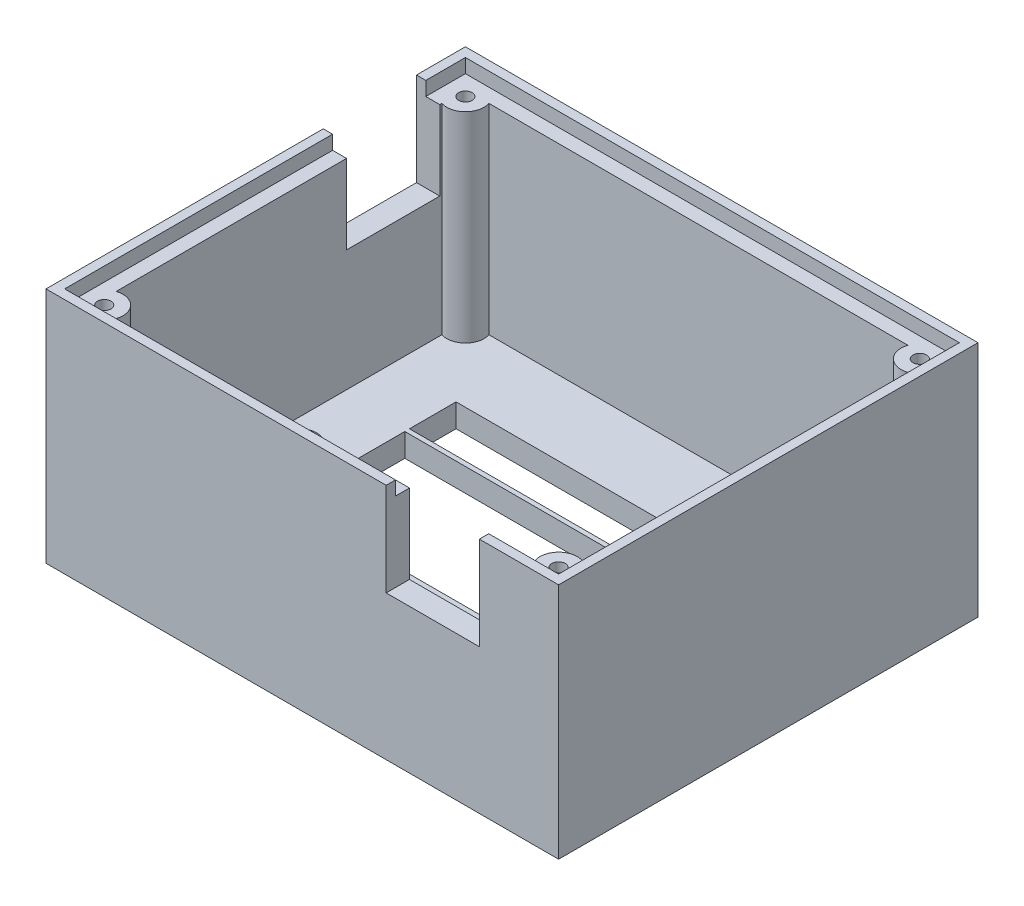
from build123d import *

# Parameters (mm, degrees)
SKETCH1_W                  = 110
SKETCH1_H                  = 90
BOSS_EXTRUDE1_DEPTH        = 51
SKETCH2_W                  = 100
SKETCH2_H                  = 80
CUT_EXTRUDE1_DEPTH         = 46
SKETCH3_W                  = 106
SKETCH3_H                  = 3
CUT_EXTRUDE2_DEPTH         = 3
SKETCH5_W                  = 3
SKETCH5_H                  = 83
CUT_EXTRUDE3_DEPTH         = 3
SKETCH6_W                  = 103
SKETCH6_H                  = 3
CUT_EXTRUDE4_DEPTH         = 3
SKETCH7_W                  = 3
SKETCH7_H                  = 80
CUT_EXTRUDE5_DEPTH         = 3
SKETCH9_R                  = 4
BOSS_EXTRUDE2_DEPTH        = 43
SKETCH10_R                 = 4
BOSS_EXTRUDE3_DEPTH        = 43
M2_5_CLEARANCE_HOLE1_D     = 2.9
M2_5_CLEARANCE_HOLE1_DEPTH = 5
M2_5_CLEARANCE_HOLE1_TIP   = 0.871247898
SKETCH14_W                 = 20
SKETCH14_H                 = 20
CUT_EXTRUDE6_DEPTH         = 5
SKETCH15_W                 = 20
SKETCH15_H                 = 20
CUT_EXTRUDE7_DEPTH         = 5
SKETCH16_W                 = 72
SKETCH16_H                 = 26
CUT_EXTRUDE8_DEPTH         = 5
SKETCH17_W                 = 72
SKETCH17_H                 = 10
CUT_EXTRUDE9_DEPTH         = 5
M6_CLEARANCE_HOLE1_D       = 6.6


with BuildPart() as part:
    # Sketch1 → Boss-Extrude1 (new body)
    with BuildSketch(Plane(origin=(0, 0, 0), x_dir=(1, 0, 0), z_dir=(0, 1, 0))):
        Rectangle(SKETCH1_W, SKETCH1_H)
    extrude(amount=BOSS_EXTRUDE1_DEPTH)

    # Sketch2 → Cut-Extrude1 (cut)
    with BuildSketch(Plane(origin=(0, 51, 0), x_dir=(1, 0, 0), z_dir=(0, 1, 0))):
        Rectangle(SKETCH2_W, SKETCH2_H)
    extrude(amount=-CUT_EXTRUDE1_DEPTH, mode=Mode.SUBTRACT)

    # Sketch3 → Cut-Extrude2 (cut)
    with BuildSketch(Plane(origin=(0, 51, 0), x_dir=(1, 0, 0), z_dir=(0, 1, 0))):
        with Locations((0, 41.5)):
            Rectangle(SKETCH3_W, SKETCH3_H)
    extrude(amount=-CUT_EXTRUDE2_DEPTH, mode=Mode.SUBTRACT)

    # Sketch5 → Cut-Extrude3 (cut)
    with BuildSketch(Plane(origin=(0, 51, 0), x_dir=(1, 0, 0), z_dir=(0, 1, 0))):
        with Locations((51.5, -1.5)):
            Rectangle(SKETCH5_W, SKETCH5_H)
    extrude(amount=-CUT_EXTRUDE3_DEPTH, mode=Mode.SUBTRACT)

    # Sketch6 → Cut-Extrude4 (cut)
    with BuildSketch(Plane(origin=(0, 51, 0), x_dir=(1, 0, 0), z_dir=(0, 1, 0))):
        with Locations((-1.5, -41.5)):
            Rectangle(SKETCH6_W, SKETCH6_H)
    extrude(amount=-CUT_EXTRUDE4_DEPTH, mode=Mode.SUBTRACT)

    # Sketch7 → Cut-Extrude5 (cut)
    with BuildSketch(Plane(origin=(0, 51, 0), x_dir=(1, 0, 0), z_dir=(0, 1, 0))):
        with Locations((-51.5, 0)):
            Rectangle(SKETCH7_W, SKETCH7_H)
    extrude(amount=-CUT_EXTRUDE5_DEPTH, mode=Mode.SUBTRACT)

    # Sketch9 → Boss-Extrude2 (add)
    with BuildSketch(Plane(origin=(0, 5, 0), x_dir=(1, 0, 0), z_dir=(0, 1, 0))):
        with Locations((-48.75, 38.75)):
            Circle(SKETCH9_R)
    extrude(amount=BOSS_EXTRUDE2_DEPTH)

    # Sketch10 → Boss-Extrude3 (add)
    with BuildSketch(Plane(origin=(0, 5, 0), x_dir=(1, 0, 0), z_dir=(0, 1, 0))):
        with Locations((48.75, 38.75)):
            Circle(SKETCH10_R)
        with Locations((48.75, -38.75)):
            Circle(SKETCH10_R)
        with Locations((-48.75, -38.75)):
            Circle(SKETCH10_R)
    extrude(amount=BOSS_EXTRUDE3_DEPTH)

    # M2.5 Clearance Hole1
    with Locations(Plane(origin=(0, 48, 0), x_dir=(1, 0, 0), z_dir=(0, 1, 0))):
        with Locations((-48.75, 38.75), (48.75, 38.75), (48.75, -38.75), (-48.75, -38.75)):
            Hole(M2_5_CLEARANCE_HOLE1_D / 2, depth=M2_5_CLEARANCE_HOLE1_DEPTH)
            with Locations((0, 0, -(M2_5_CLEARANCE_HOLE1_DEPTH + M2_5_CLEARANCE_HOLE1_TIP / 2))):  # 118° drill point
                Cone(0, M2_5_CLEARANCE_HOLE1_D / 2, M2_5_CLEARANCE_HOLE1_TIP, mode=Mode.SUBTRACT)

    # Sketch14 → Cut-Extrude6 (cut)
    with BuildSketch(Plane.ZY.offset(55)):
        with Locations((-24.5, 41)):
            Rectangle(SKETCH14_W, SKETCH14_H)
    extrude(amount=-CUT_EXTRUDE6_DEPTH, mode=Mode.SUBTRACT)

    # Sketch15 → Cut-Extrude7 (cut)
    with BuildSketch(Plane.XY.offset(45)):
        with Locations((28, 41)):
            Rectangle(SKETCH15_W, SKETCH15_H)
    extrude(amount=-CUT_EXTRUDE7_DEPTH, mode=Mode.SUBTRACT)

    # Sketch16 → Cut-Extrude8 (cut)
    with BuildSketch(Plane(origin=(0, 5, 0), x_dir=(1, 0, 0), z_dir=(0, 1, 0))):
        Rectangle(SKETCH16_W, SKETCH16_H)
    extrude(amount=-CUT_EXTRUDE8_DEPTH, mode=Mode.SUBTRACT)

    # Sketch17 → Cut-Extrude9 (cut)
    with BuildSketch(Plane.XZ):
        with Locations((0, -19)):
            Rectangle(SKETCH17_W, SKETCH17_H)
    extrude(amount=-CUT_EXTRUDE9_DEPTH, mode=Mode.SUBTRACT)

    # M6 Clearance Hole1 (through all)
    with Locations(Plane(origin=(0, 0, 0), x_dir=(-1, 0, 0), z_dir=(0, -1, 0))):
        with Locations((45.222794008, 0)):
            Hole(M6_CLEARANCE_HOLE1_D / 2)


solid = part.part
